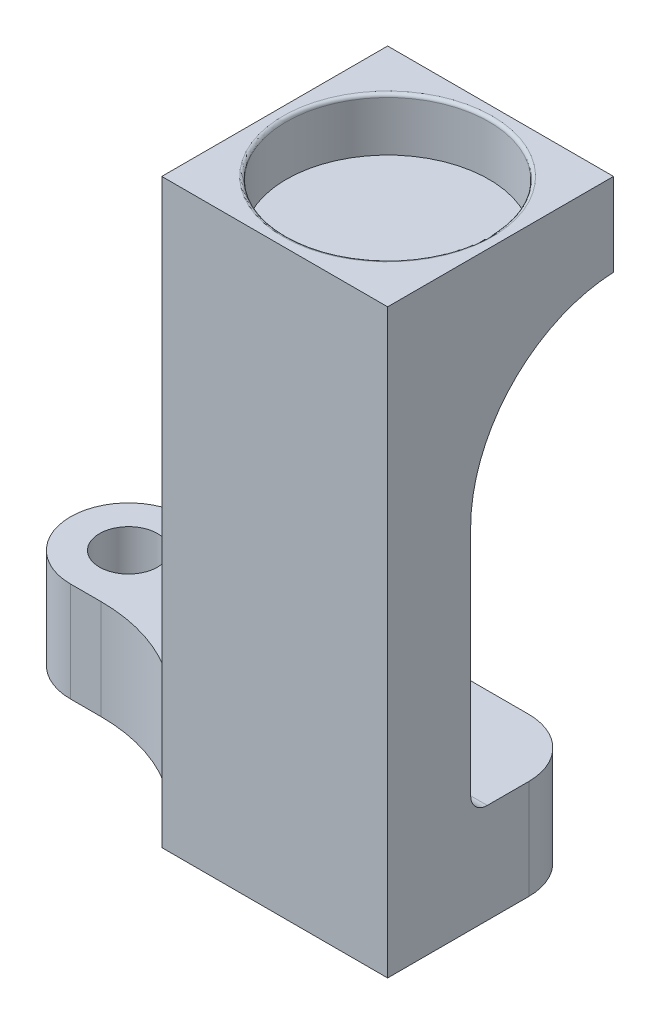
from build123d import *

# Parameters (mm, degrees)
SKETCH1_W           = 13.6
SKETCH1_H           = 13.6
BOSS_EXTRUDE1_DEPTH = 5
SKETCH2_R           = 6.1
CUT_EXTRUDE1_DEPTH  = 3.2
SKETCH3_W           = 13.6
SKETCH3_H           = 5
BOSS_EXTRUDE2_DEPTH = 30
FILLET1_R           = 0.2
FILLET2_R           = 9
SKETCH10_W          = 27.6
SKETCH10_H          = 6
BOSS_EXTRUDE5_DEPTH = 7
SKETCH11_R          = 1.75
CUT_EXTRUDE4_DEPTH  = 37.330152766
FILLET3_R           = 10
FILLET4_R           = 3.5
FILLET5_R           = 1


# Some blends are built 0.0001 mm under size
with BuildPart() as part:
    # Sketch1 → Boss-Extrude1 (new body)
    with BuildSketch(Plane(origin=(0, 0, 0), x_dir=(1, 0, 0), z_dir=(0, 1, 0))):
        Rectangle(SKETCH1_W, SKETCH1_H)
    extrude(amount=BOSS_EXTRUDE1_DEPTH)

    # Sketch2 → Cut-Extrude1 (cut)
    with BuildSketch(Plane(origin=(0, 5, 0), x_dir=(1, 0, 0), z_dir=(0, 1, 0))):
        with Locations(Location((0, 0, 0), (0, 0, 270))):
            Circle(SKETCH2_R)
    extrude(amount=-CUT_EXTRUDE1_DEPTH, mode=Mode.SUBTRACT)

    # Sketch3 → Boss-Extrude2 (add)
    with BuildSketch(Plane.XZ):
        with Locations((0, 4.3)):
            Rectangle(SKETCH3_W, SKETCH3_H)
    extrude(amount=BOSS_EXTRUDE2_DEPTH)

    # Fillet1
    fillet1_edges = [part.edges().sort_by_distance(p)[0] for p in [
        (0, 5, -6.1),
    ]]
    fillet(fillet1_edges, radius=FILLET1_R)

    # Fillet2
    # the kernel refuses this fillet: 9 mm, written as the material it adds along each edge
    with BuildSketch(Plane(origin=(6.8, 0, 1.8), x_dir=(0, 0, -1), z_dir=(-1, 0, 0))) as fillet2_piece_1:
        with BuildLine():
            CenterArc((9, 8.991106717), FILLET2_R, 180, 87.452681817)
            Line((0, 8.991106717), (-0.18, 8.991106717))
            Line((-0.18, 8.991106717), (-0.18, 0))
            Line((-0.18, 0), (0, -0.18))
            ThreePointArc((0, -0.18), (4.3, -0.18), (8.592, -0.179822134))
            Line((8.592, -0.179822134), (8.6, 0))
        make_face()
    extrude(amount=13.6)

    # Sketch10 → Boss-Extrude5 (add)
    with BuildSketch(Plane(origin=(0, 0, 1.8), x_dir=(-1, 0, 0), z_dir=(0, 0, -1))):
        with Locations((7, -27)):
            Rectangle(SKETCH10_W, SKETCH10_H)
    extrude(amount=BOSS_EXTRUDE5_DEPTH)

    # Sketch11 → Cut-Extrude4 (cut, through all)
    with BuildSketch(Plane(origin=(0, -24, 0), x_dir=(1, 0, 0), z_dir=(0, 1, 0))):
        with Locations(Location((-10.3, 1.7, 0), (0, 0, 270))):
            Circle(SKETCH11_R)
        with Locations(Location((-17.3, 1.7, 0), (0, 0, 270))):
            Circle(SKETCH11_R)
    extrude(amount=-CUT_EXTRUDE4_DEPTH, mode=Mode.SUBTRACT)

    # Fillet3
    # the kernel refuses this fillet: 10 mm, written as the material it adds along each edge
    with BuildSketch(Plane(origin=(-6.8, -24, 1.8), x_dir=(0, 0, 1), z_dir=(0, -1, 0))) as fillet3_piece_1:
        with BuildLine():
            CenterArc((10, 8.660254038), FILLET3_R, 180, 60)
            Line((0, 8.660254038), (0, 0))
            Line((0, 0), (5, 0))
        make_face()
    extrude(amount=6)

    # Fillet4
    fillet4_edges = [part.edges().sort_by_distance(p)[0] for p in [
        (-20.8, -27, 1.8),
        (-20.8, -27, -5.2),
        (6.8, -27, -5.2),
    ]]
    fillet(fillet4_edges, radius=FILLET4_R - 0.0001)  # a hair under: the kernel refuses the full size

    # Fillet5
    fillet5_edges = [part.edges().sort_by_distance(p)[0] for p in [
        (0, -24, 1.8),
        (-6.8, -24, 4.3),
    ]]
    fillet(fillet5_edges, radius=FILLET5_R)


solid = part.part
